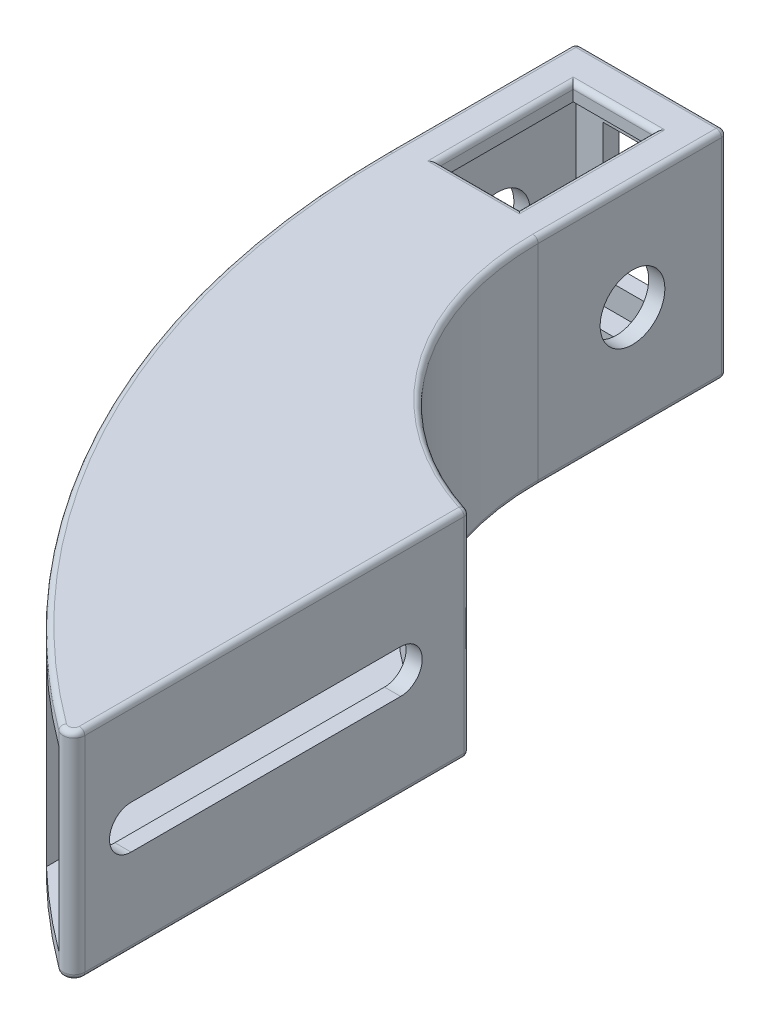
from build123d import *

# Parameters (mm, degrees)
BOSS_EXTRUDE1_DEPTH     = 20
SHELL1_T                = 3
CUT_EXTRUDE1_REACH      = 175.853
SKETCH4_W               = 15
SKETCH4_H               = 25
CUT_EXTRUDE2_DEPTH      = 178.270979012
CUT_EXTRUDE3_REACH      = 175.853
SKETCH5_W               = 12
SKETCH5_H               = 25
SKETCH6_R               = 6
CUT_EXTRUDE4_DEPTH      = 166.435788148
CUT_EXTRUDE5_REACH      = 175.853
CUT_EXTRUDE5_END_RADIUS = 149.692307692
SKETCH7_W               = 15
SKETCH7_H               = 33
FILLET1_R               = 2
FILLET2_R               = 1


with BuildPart() as part:
    # Sketch2 → Boss-Extrude1 (new, symmetric)
    with BuildSketch(Plane(origin=(0, 0, 0), x_dir=(1, 0, 0), z_dir=(0, 1, 0))):
        with BuildLine():
            Line((65, 0), (65, 75))
            ThreePointArc((65, 75), (38.25588773, 93.89935692), (28, 125))
            Line((28, 125), (28, 160))
            Line((28, 160), (0, 160))
            Line((0, 160), (0, 125))
            ThreePointArc((0, 125), (17.221126888, 54.554985982), (65, 0))
        make_face()
    extrude(amount=BOSS_EXTRUDE1_DEPTH, both=True)

    # Shell1 (no face opened: a closed hollow body)
    add(offset(amount=-SHELL1_T, mode=Mode.PRIVATE), mode=Mode.SUBTRACT)

    # Sketch3 → Cut-Extrude1 (cut, up to next)
    with BuildSketch(Plane(origin=(65, 0, 0), x_dir=(0, 0, -1), z_dir=(1, 0, 0)), mode=Mode.PRIVATE) as cut_extrude1_sk1:
        with BuildLine():
            Line((12.5, 4), (62.5, 4))
            ThreePointArc((62.5, 4), (66.5, 0), (62.5, -4))
            Line((62.5, -4), (12.5, -4))
            ThreePointArc((12.5, -4), (8.5, 0), (12.5, 4))
        make_face()
    cut_extrude1_tool1 = extrude(cut_extrude1_sk1.sketch, amount=-CUT_EXTRUDE1_REACH, mode=Mode.PRIVATE) & part.part
    add(cut_extrude1_tool1.solids().sort_by_distance((65, 0, -37.5))[0], mode=Mode.SUBTRACT)

    # Sketch4 → Cut-Extrude2 (cut, through all)
    with BuildSketch(Plane(origin=(0, 20, 0), x_dir=(1, 0, 0), z_dir=(0, 1, 0))):
        with Locations((14, 140.5)):
            Rectangle(SKETCH4_W, SKETCH4_H)
    extrude(amount=-CUT_EXTRUDE2_DEPTH, mode=Mode.SUBTRACT)

    # Sketch5 → Cut-Extrude3 (cut, up to next)
    with BuildSketch(Plane(origin=(0, 0, -160), x_dir=(-1, 0, 0), z_dir=(0, 0, -1)), mode=Mode.PRIVATE) as cut_extrude3_sk1:
        with Locations((-14, 0)):
            Rectangle(SKETCH5_W, SKETCH5_H)
    cut_extrude3_tool1 = extrude(cut_extrude3_sk1.sketch, amount=-CUT_EXTRUDE3_REACH, mode=Mode.PRIVATE) & part.part
    add(cut_extrude3_tool1.solids().sort_by_distance((14, 0, -160))[0], mode=Mode.SUBTRACT)

    # Sketch6 → Cut-Extrude4 (cut, through all)
    with BuildSketch(Plane(origin=(28, 0, 0), x_dir=(0, 0, -1), z_dir=(1, 0, 0))):
        with Locations((142.5, 0)):
            Circle(SKETCH6_R)
    extrude(amount=-CUT_EXTRUDE4_DEPTH, mode=Mode.SUBTRACT)

    # Cut-Extrude5: up to this cylinder (the profile starts outside it)
    cut_extrude5_end = Plane(origin=(152.692307692, 0, -125), z_dir=(0, -1, 0)) * Cylinder(CUT_EXTRUDE5_END_RADIUS, 652.090615385, mode=Mode.PRIVATE)
    # Sketch7 → Cut-Extrude5 (cut, up to the surface)
    with BuildSketch(Plane.XY, mode=Mode.PRIVATE) as cut_extrude5_sk1:
        with Locations((54.5, 0)):
            Rectangle(SKETCH7_W, SKETCH7_H)
    cut_extrude5_tool1 = extrude(cut_extrude5_sk1.sketch, amount=-CUT_EXTRUDE5_REACH, mode=Mode.PRIVATE) - cut_extrude5_end
    add(cut_extrude5_tool1.solids().sort_by_distance((54.5, 0, 0))[0], mode=Mode.SUBTRACT)

    # Fillet1
    # the kernel refuses this fillet: 2 mm, written as the material it takes off along each edge
    with BuildSketch(Plane(origin=(65, -29.832655727, 0), x_dir=(-0.8111753720748651, 0, -0.584802971725695), z_dir=(0, 1, 0))) as fillet1_piece_1:
        with BuildLine():
            CenterArc((3.9073042, -1.999834123), FILLET1_R, 89.26206466, 126.527007428)
            Line((2.284953456, -3.169440067), (0, 0))
            ThreePointArc((0, 0), (1.966531145, 0.012664047), (3.933062291, 0))
        make_face()
    extrude(amount=59.665311453, mode=Mode.SUBTRACT)

    # Fillet2
    fillet2_edges = [part.edges().sort_by_distance(p)[0] for p in [
        (38.25588773, 20, -93.89935692),
        (0, 0, -160),
        (28, 0, -160),
        (65, 0, -75),
        (65, -20, -39.453609648),
        (65, 20, -39.453609648),
        (63.899775935, -20, -2.121049297),
        (63.899775935, 20, -2.121049297),
        (28, 20, -142.5),
        (14, 20, -160),
        (0, 20, -142.5),
        (16.325098118, 20, -56.305568047),
        (21.5, -20, -140.5),
        (14, -20, -128),
        (6.5, -20, -140.5),
        (14, -20, -153),
        (21.5, 20, -140.5),
        (14, 20, -153),
        (6.5, 20, -140.5),
        (14, 20, -128),
        (0, -20, -142.5),
        (14, -20, -160),
        (28, -20, -142.5),
        (38.25588773, -20, -93.89935692),
        (16.325098118, -20, -56.305568047),
    ]]
    fillet(fillet2_edges, radius=FILLET2_R)


solid = part.part
